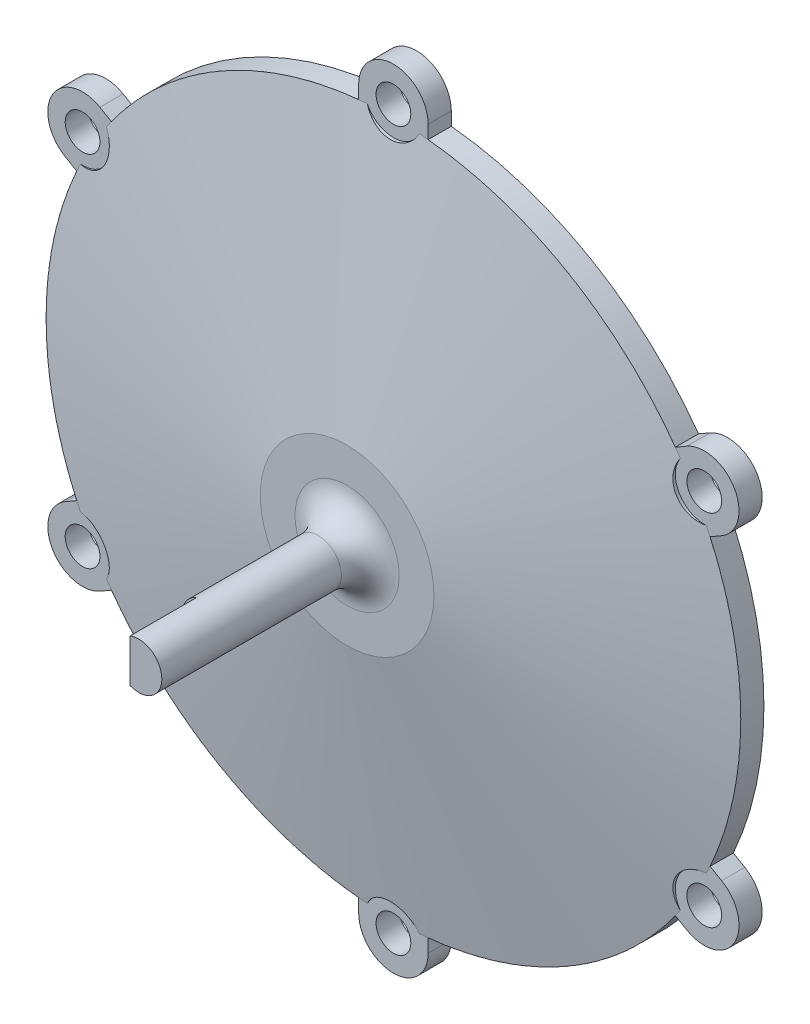
from build123d import *

# Parameters (mm, degrees)
SKETCH1_R           = 57
BOSS_EXTRUDE1_DEPTH = 4
SKETCH4_R           = 14
CUT_EXTRUDE1_DEPTH  = 7
SKETCH9_R           = 11.5
CUT_EXTRUDE4_DEPTH  = 0.5
SKETCH10_R          = 4
BOSS_EXTRUDE2_DEPTH = 36
FILLET1_R           = 5
SKETCH7_R           = 3
CUT_EXTRUDE2_DEPTH  = 101.796825347
SKETCH8_R           = 5
CUT_EXTRUDE3_DEPTH  = 101.796825347
CIRPATTERN6_COUNT   = 6
SKETCH11_W          = 2.5
SKETCH11_H          = 7.416198488
CUT_EXTRUDE5_DEPTH  = 11.5


with BuildPart() as part:
    # Sketch1 → Boss-Extrude1 (new body)
    with BuildSketch(Plane.XY):
        with BuildLine():
            ThreePointArc((6, 62), (0, 68), (-6, 62))
            Line((-6, 62), (-6, 59.699246226))
            ThreePointArc((-6, 59.699246226), (-30, 51.961524227), (-48.701063819, 35.045775536))
            Line((-48.701063819, 35.045775536), (-50.693575035, 36.196152423))
            ThreePointArc((-50.693575035, 36.196152423), (-58.889727457, 34), (-56.693575035, 25.803847577))
            Line((-56.693575035, 25.803847577), (-54.701063819, 24.65347069))
            ThreePointArc((-54.701063819, 24.65347069), (-60, 0), (-54.701063819, -24.65347069))
            Line((-54.701063819, -24.65347069), (-56.693575035, -25.803847577))
            ThreePointArc((-56.693575035, -25.803847577), (-58.889727457, -34), (-50.693575035, -36.196152423))
            Line((-50.693575035, -36.196152423), (-48.701063819, -35.045775536))
            ThreePointArc((-48.701063819, -35.045775536), (-30, -51.961524227), (-6, -59.699246226))
            Line((-6, -59.699246226), (-6, -62))
            ThreePointArc((-6, -62), (0, -68), (6, -62))
            Line((6, -62), (6, -59.699246226))
            ThreePointArc((6, -59.699246226), (30, -51.961524227), (48.701063819, -35.045775536))
            Line((48.701063819, -35.045775536), (50.693575035, -36.196152423))
            ThreePointArc((50.693575035, -36.196152423), (58.889727457, -34), (56.693575035, -25.803847577))
            Line((56.693575035, -25.803847577), (54.701063819, -24.65347069))
            ThreePointArc((54.701063819, -24.65347069), (60, 0), (54.701063819, 24.65347069))
            Line((54.701063819, 24.65347069), (56.693575035, 25.803847577))
            ThreePointArc((56.693575035, 25.803847577), (58.889727457, 34), (50.693575035, 36.196152423))
            Line((50.693575035, 36.196152423), (48.701063819, 35.045775536))
            ThreePointArc((48.701063819, 35.045775536), (30, 51.961524227), (6, 59.699246226))
            Line((6, 59.699246226), (6, 62))
        make_face()
        Circle(SKETCH1_R, mode=Mode.SUBTRACT)
    extrude(amount=BOSS_EXTRUDE1_DEPTH)

    # Sketch7 → Cut-Extrude2 (cut, through all)
    with BuildSketch(Plane.XY.offset(4)):
        with Locations((0, 62)):
            Circle(SKETCH7_R)
    cut_extrude2 = extrude(amount=-CUT_EXTRUDE2_DEPTH, mode=Mode.SUBTRACT)


with BuildPart() as body_2:
    # Sketch3 → Revolve1 (revolve)
    with BuildSketch(Plane(origin=(0, 0, 0), x_dir=(1, 0, 0), z_dir=(0, 1, 0))):
        Polygon((0, -0.5), (0, -12), (15, -12), (60, -4), (57, -4), (57, -0.5), align=None)
    revolve(axis=Axis((0, 0, 12), (0, 0, -1)))

    # Sketch4 → Cut-Extrude1 (cut)
    with BuildSketch(Plane.XY.offset(0.5)):
        Circle(SKETCH4_R)
    extrude(amount=CUT_EXTRUDE1_DEPTH, mode=Mode.SUBTRACT)

    # Sketch9 → Cut-Extrude4 (cut)
    with BuildSketch(Plane(origin=(0, 0, 7.5), x_dir=(-1, 0, 0), z_dir=(0, 0, -1))):
        Circle(SKETCH9_R)
    extrude(amount=-CUT_EXTRUDE4_DEPTH, mode=Mode.SUBTRACT)

    # Sketch10 → Boss-Extrude2 (add)
    with BuildSketch(Plane.XY.offset(12)):
        Circle(SKETCH10_R)
    extrude(amount=BOSS_EXTRUDE2_DEPTH)

    # Fillet1
    fillet1_edges = [body_2.edges().sort_by_distance(p)[0] for p in [
        (-4, 0, 12),
    ]]
    fillet(fillet1_edges, radius=FILLET1_R)

    # Sketch8 → Cut-Extrude3 (cut, through all)
    with BuildSketch(Plane.XY.offset(4)):
        with Locations((0, 62)):
            Circle(SKETCH8_R)
    cut_extrude3 = extrude(amount=CUT_EXTRUDE3_DEPTH, mode=Mode.SUBTRACT)


with BuildPart() as cirpattern6_tool:
    # CirPattern6: Cut-Extrude2, Cut-Extrude3 ×6 about axis
    cirpattern6_axis = Axis((0, 0, 4), (0, 0, 1))
    add([cut_extrude2.rotate(cirpattern6_axis, i * 360 / CIRPATTERN6_COUNT) for i in range(1, CIRPATTERN6_COUNT)])
    add([cut_extrude3.rotate(cirpattern6_axis, i * 360 / CIRPATTERN6_COUNT) for i in range(1, CIRPATTERN6_COUNT)])


with BuildPart() as part_1:
    add(part.part)

    # CirPattern6: cut by cirpattern6_tool
    add(cirpattern6_tool.part, mode=Mode.SUBTRACT)


with BuildPart() as body_2_1:
    add(body_2.part)

    # CirPattern6: cut by cirpattern6_tool
    add(cirpattern6_tool.part, mode=Mode.SUBTRACT)

    # Sketch11 → Cut-Extrude5 (cut)
    with BuildSketch(Plane.XY.offset(48)):
        with Locations((-2.75, 0)):
            Rectangle(SKETCH11_W, SKETCH11_H)
    extrude(amount=-CUT_EXTRUDE5_DEPTH, mode=Mode.SUBTRACT)


solid = Compound([part_1.part, body_2_1.part])
